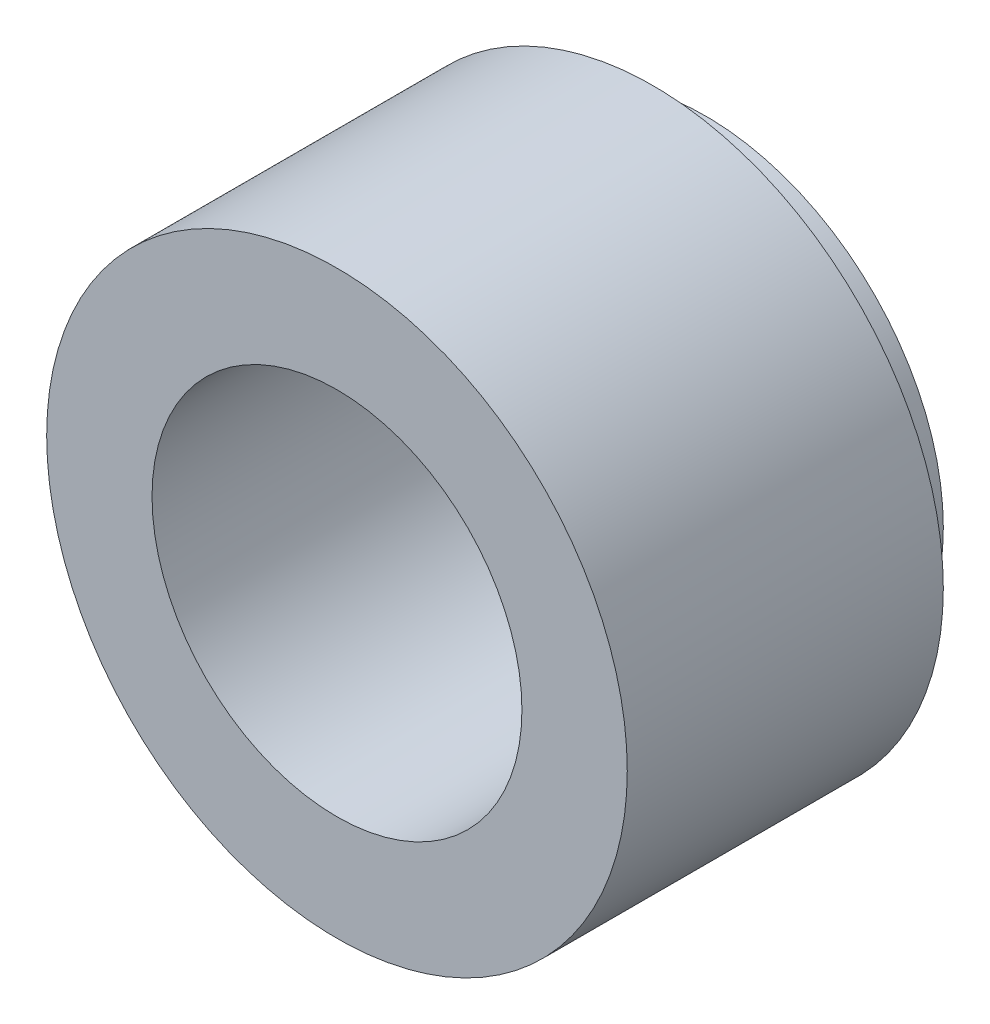
from build123d import *


with BuildPart() as part:
    # Sketch1 → Revolve1 (revolve)
    with BuildSketch(Plane(origin=(0, 0, 0), x_dir=(0, 0, -1), z_dir=(1, 0, 0))):
        Polygon((-13.145457686, 10.116968004), (-13.145457686, 17.350888004), (8.556302314, 17.350888004), (8.556302314, 13.733928004), (12.173262314, 13.733928004), (12.173262314, 10.116968004), align=None)
    revolve(axis=Axis((0, -2.583031996, 33.72322668), (0, 0, -1)))


solid = part.part
